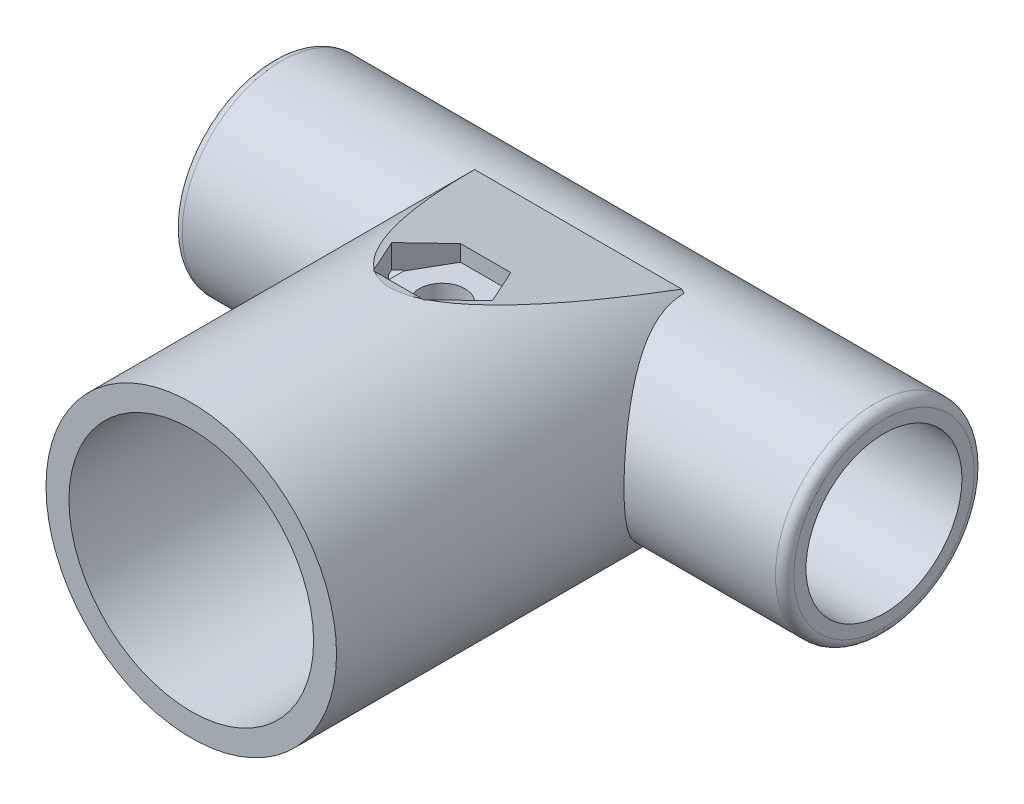
from build123d import *

# Parameters (mm, degrees)
SKETCH_3_R               = 6.5
SKETCH_3_R_2             = 5.1
EXTRUDE_1_DEPTH          = 20
EXTRUDE_START            = -18.7999999
EXTRUDE_2_OUTLINE_R      = 9.5
EXTRUDE_2_DEPTH          = 18.7999999
EXTRUDE_START_2          = -31.801
EXTRUDE_2_2_OUTLINE_R    = 9.5
EXTRUDE_2_2_DEPTH        = 0.0009999
EXTRUDE_START_3          = -31.8000001
EXTRUDE_2_3_OUTLINE_R    = 9.5
EXTRUDE_2_3_DEPTH        = 13.0000002
EXTRUDE_START_4          = -9.5000001
EXTRUDE_2_4_OUTLINE_R    = 6.5
EXTRUDE_2_4_DEPTH        = 19.5000001
CUT_EXTRUDE_1_DEPTH      = 39.749885281
CUT_EXTRUDE_1_DEPTH_BACK = 39.749885281
CUT_EXTRUDE_2_DEPTH      = 39.749064529
CUT_EXTRUDE_2_DEPTH_BACK = 39.749064529
SHELL_1_T                = -1.5
FILLET_1_R               = 0.6
EXTRUDE_START_5          = 6
SKETCH_6_W               = 4.8
SKETCH_6_H               = 6
SKETCH_6_R               = 1.5
EXTRUDE_3_DEPTH          = 1.729857
CUT_EXTRUDE_3_DEPTH      = 39.749064611
CUT_EXTRUDE_3_DEPTH_BACK = 39.749064611
SKETCH_6_2_R             = 1.5
CUT_EXTRUDE_START        = 9.5
CUT_EXTRUDE_4_DEPTH      = 2.5
CUT_EXTRUDE_START_2      = -9.5
SKETCH_8_R               = 2.5
CUT_EXTRUDE_5_DEPTH      = 1


with BuildPart() as part:
    # 草圖3 → 填料-伸長1 (new, symmetric)
    with BuildSketch(Plane(origin=(0, 0, 0), x_dir=(0, 0, -1), z_dir=(1, 0, 0))):
        with Locations((25.3, 0)):
            Circle(SKETCH_3_R)
        with Locations((25.3, 0)):
            Circle(SKETCH_3_R_2, mode=Mode.SUBTRACT)
    extrude(amount=EXTRUDE_1_DEPTH, both=True)

    # 圓角1
    fillet_1_edges = [part.edges().sort_by_distance(p)[0] for p in [
        (-20, 0, -18.8),
        (20, 0, -18.8),
    ]]
    fillet(fillet_1_edges, radius=FILLET_1_R)



with BuildPart() as body_2:
    # 填料-伸長2: read off the stored shape, not the designer's step
    # 填料-伸長2 outline → 填料-伸長2 (new body)
    with BuildSketch(Plane.XY.offset(EXTRUDE_START)):
        Circle(EXTRUDE_2_OUTLINE_R)
    extrude(amount=EXTRUDE_2_DEPTH)

    # Extrude 2 2 outline → Extrude 2 2 (add)
    with BuildSketch(Plane.XY.offset(EXTRUDE_START_2)):
        Circle(EXTRUDE_2_2_OUTLINE_R)
    extrude(amount=EXTRUDE_2_2_DEPTH)

    # Extrude 2 3 outline → Extrude 2 3 (add)
    with BuildSketch(Plane.XY.offset(EXTRUDE_START_3)):
        Circle(EXTRUDE_2_3_OUTLINE_R)
    extrude(amount=EXTRUDE_2_3_DEPTH)

    # Extrude 2 4 outline → Extrude 2 4 (cut)
    with BuildSketch(Plane.YZ.offset(EXTRUDE_START_4)):
        with Locations((0, -25.3)):
            Circle(EXTRUDE_2_4_OUTLINE_R)
    extrude(amount=EXTRUDE_2_4_DEPTH, mode=Mode.SUBTRACT)

    # 草圖4 → 除料-伸長1 (cut, two sides: drawn at the far end of the back side and taken through both)
    with BuildSketch(Plane(origin=(0, 0, 0), x_dir=(0, 0, -1), z_dir=(1, 0, 0)).offset(-CUT_EXTRUDE_1_DEPTH_BACK)):
        with BuildLine():
            Line((25.3, -12.675131419), (25.3, -6.5))
            ThreePointArc((25.3, -6.5), (31.8, 0), (25.3, 6.5))
            Line((25.3, 6.5), (25.3, 12.675131419))
            ThreePointArc((25.3, 12.675131419), (37.975131419, 0), (25.3, -12.675131419))
        make_face()
    extrude(amount=CUT_EXTRUDE_1_DEPTH + CUT_EXTRUDE_1_DEPTH_BACK, mode=Mode.SUBTRACT)

    # 草圖5 → 除料-伸長2 (cut, two sides: drawn at the far end of the back side and taken through both)
    with BuildSketch(Plane(origin=(0, 0, 0), x_dir=(0, 0, -1), z_dir=(1, 0, 0)).offset(-CUT_EXTRUDE_2_DEPTH_BACK)):
        Polygon((26.434429002, 6.400239905), (13, 9.5), (13, 10.602524511), (26.434429002, 10.602524511), align=None)
        Polygon((13, -10.602524511), (13, -9.5), (26.434429002, -6.400239905), (26.434429002, -10.602524511), align=None)
    extrude(amount=CUT_EXTRUDE_2_DEPTH + CUT_EXTRUDE_2_DEPTH_BACK, mode=Mode.SUBTRACT)

    # 薄殼1
    shell_1_openings = [body_2.faces().sort_by_distance(p)[0] for p in [
        (0, 0, 0),
    ]]
    offset(amount=SHELL_1_T, openings=shell_1_openings)


with BuildPart() as part_1:
    add(part.part)

    add(body_2.part)  # 填料-伸長3 merges body 2
    # 草圖6 → 填料-伸長3 (add)
    with BuildSketch(Plane(origin=(0, 0, 0), x_dir=(0, 0, -1), z_dir=(0, 1, 0)).offset(EXTRUDE_START_5)):
        with Locations((16.4, 0)):
            Rectangle(SKETCH_6_W, SKETCH_6_H)
        with Locations((16.4, 0)):
            Circle(SKETCH_6_R, mode=Mode.SUBTRACT)
    extrude_3 = extrude(amount=EXTRUDE_3_DEPTH)

    # 鏡射1: 填料-伸長3 across plane
    add(extrude_3.mirror(Plane.ZX))

    # 草圖6<2> → 除料-伸長3 (cut, two sides: drawn at the far end of the back side and taken through both)
    with BuildSketch(Plane(origin=(0, 0, 0), x_dir=(0, 0, -1), z_dir=(0, 1, 0)).offset(-CUT_EXTRUDE_3_DEPTH_BACK)):
        with Locations(Location((16.4, 0, 0), (0, 0, 180))):
            Circle(SKETCH_6_2_R)
    extrude(amount=CUT_EXTRUDE_3_DEPTH + CUT_EXTRUDE_3_DEPTH_BACK, mode=Mode.SUBTRACT)

    # 草圖7 → 除料-伸長4 (cut)
    with BuildSketch(Plane(origin=(0, 0, 0), x_dir=(1, 0, 0), z_dir=(0, 1, 0)).offset(CUT_EXTRUDE_START)):
        Polygon((3.290896534, 16.4), (1.645448267, 19.25), (-1.645448267, 19.25), (-3.290896534, 16.4), (-1.645448267, 13.55), (1.645448267, 13.55), align=None)
    extrude(amount=-CUT_EXTRUDE_4_DEPTH, mode=Mode.SUBTRACT)

    # 草圖8 → 除料-伸長5 (cut)
    with BuildSketch(Plane(origin=(0, 0, 0), x_dir=(1, 0, 0), z_dir=(0, 1, 0)).offset(CUT_EXTRUDE_START_2)):
        with Locations((0, 16.4)):
            Circle(SKETCH_8_R)
    extrude(amount=CUT_EXTRUDE_5_DEPTH, mode=Mode.SUBTRACT)


solid = part_1.part
